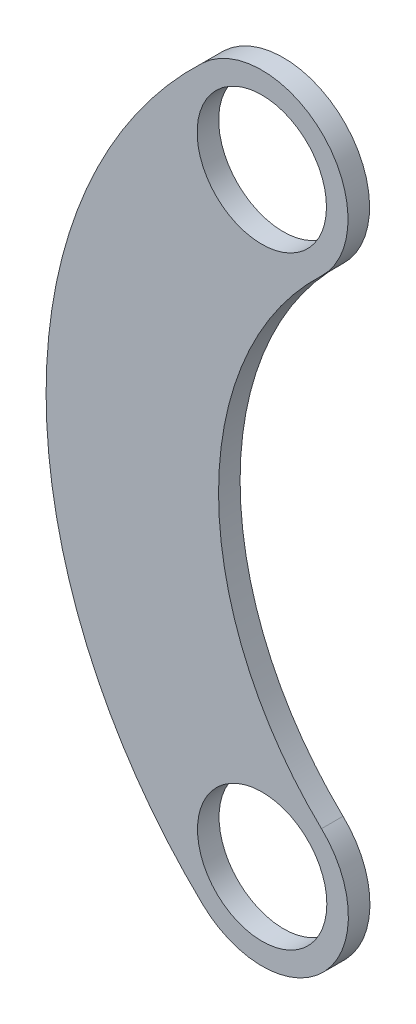
from build123d import *

# Parameters (mm, degrees)
ESQUISSE1_R               = 3
T_LE_DE_BASE_PLI_E1_DEPTH = 1


# Sheet-metal steps are written as plain solids
with BuildPart() as part:
    # Esquisse1 → Tôle de base pliée1 (new body)
    with BuildSketch(Plane.XY):
        with BuildLine():
            ThreePointArc((-57.239284083, -19.336263861), (-64.490656247, -36.242246604), (-57.218655547, -53.139366375))
            ThreePointArc((-57.218655547, -53.139366375), (-51.563834313, -52.987719377), (-51.715481312, -47.332898143))
            ThreePointArc((-51.715481312, -47.332898143), (-56.490657737, -36.237364559), (-51.729027089, -25.136011084))
            ThreePointArc((-51.729027089, -25.136011084), (-51.584281974, -19.481008975), (-57.239284083, -19.336263861))
        make_face()
        with Locations((-54.484155586, -22.236137473)):
            Circle(ESQUISSE1_R, mode=Mode.SUBTRACT)
        with Locations((-54.467068429, -50.236132259)):
            Circle(ESQUISSE1_R, mode=Mode.SUBTRACT)
    extrude(amount=-T_LE_DE_BASE_PLI_E1_DEPTH)


solid = part.part
